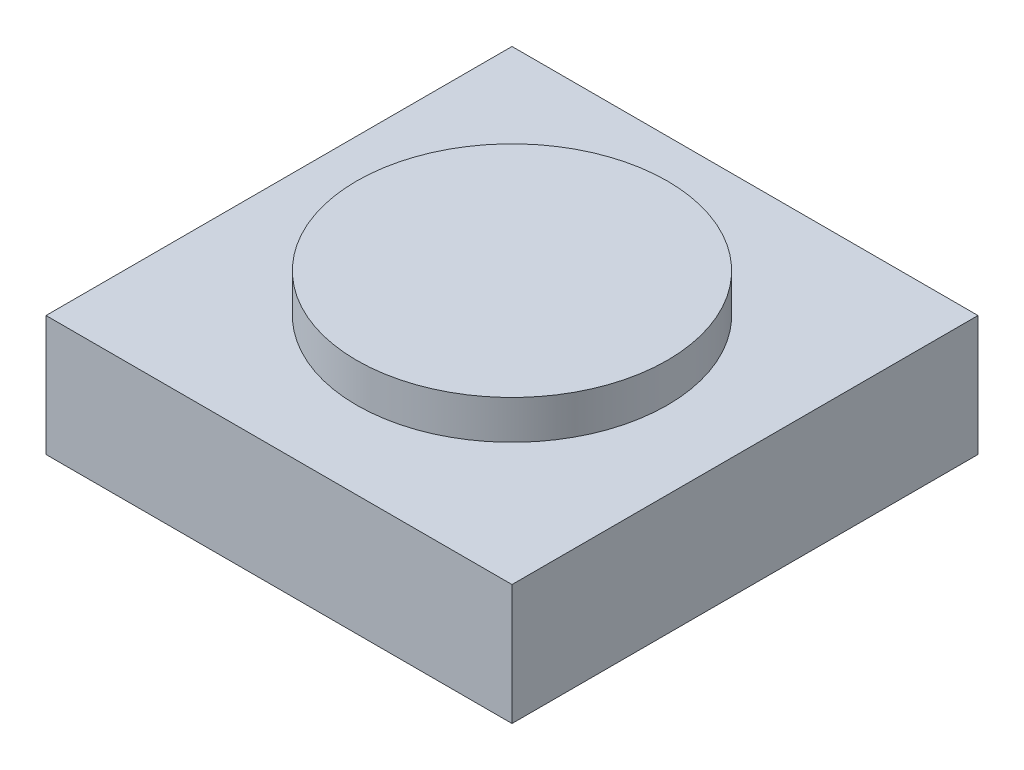
from build123d import *

# Parameters (mm, degrees)
SKETCH_1_W      = 12
SKETCH_1_H      = 12
EXTRUDE_1_DEPTH = 3.1
SKETCH_2_R      = 4
EXTRUDE_2_DEPTH = 1


with BuildPart() as part:
    # 草图1 → 拉伸1 (new body)
    with BuildSketch(Plane(origin=(0, 0, 0), x_dir=(1, 0, 0), z_dir=(0, 1, 0))):
        Rectangle(SKETCH_1_W, SKETCH_1_H)
    extrude(amount=EXTRUDE_1_DEPTH)

    # 草图2 → 拉伸2 (add)
    with BuildSketch(Plane(origin=(0, 3.1, 0), x_dir=(-1, 0, 0), z_dir=(0, 1, 0))):
        Circle(SKETCH_2_R)
    extrude(amount=EXTRUDE_2_DEPTH)


solid = part.part
